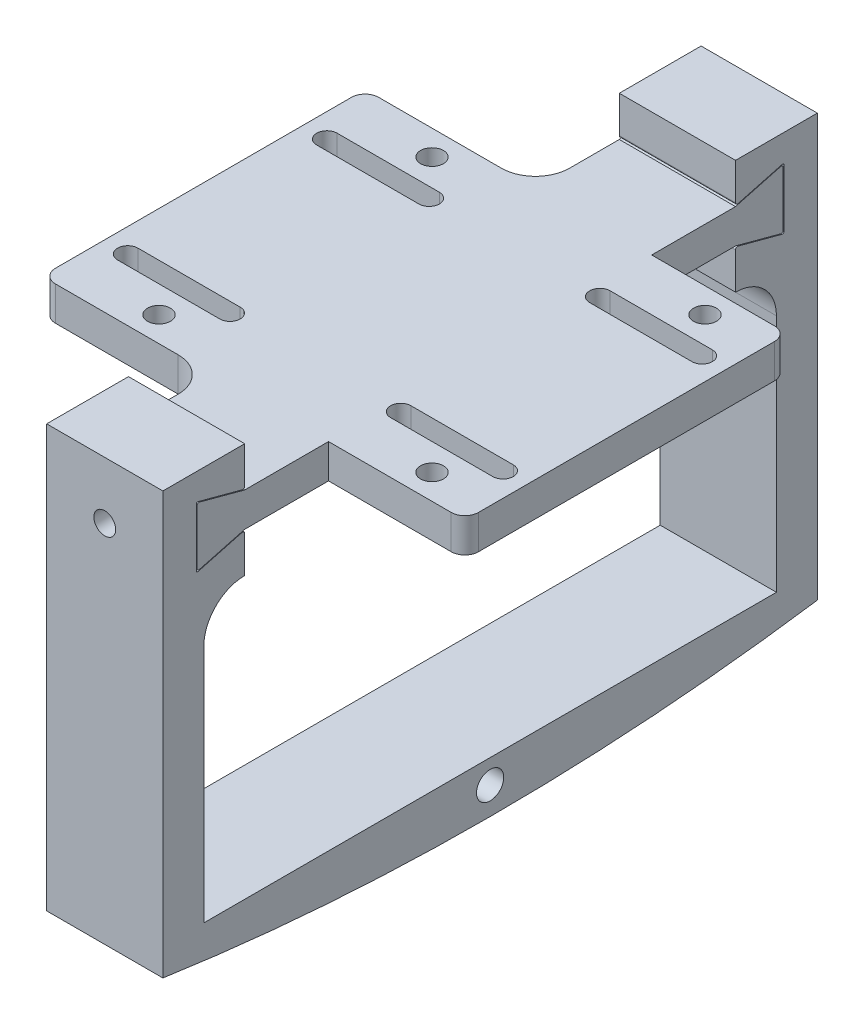
from build123d import *

# Parameters (mm, degrees)
SKETCH1_R                       = 1.6800000000000102
BOSS_EXTRUDE1_DEPTH             = 5
SKETCH3_W                       = 17.05000000000101
SKETCH3_H                       = 19.294999999999526
BOSS_EXTRUDE2_DEPTH             = 5
BOSS_EXTRUDE3_DEPTH             = 17.05
FILLET1_R                       = 5
BOSS_EXTRUDE4_REACH             = 56.956
SKETCH7_R                       = 2.000000000000002
BOSS_EXTRUDE4_DIRECTION_2_REACH = 56.956
CUT_EXTRUDE1_DEPTH              = 88.24936962523023
CUT_EXTRUDE2_DEPTH              = 114.2388449815347
FILLET2_R                       = 0.3
FILLET3_R                       = 0.3
FILLET4_R                       = 0.2
FILLET5_R                       = 6
SKETCH11_R                      = 1.6000000000000003
CUT_EXTRUDE3_DEPTH              = 15


with BuildPart() as part:
    # Sketch1 → Boss-Extrude1 (new body)
    with BuildSketch(Plane(origin=(0, 0, 0), x_dir=(1, 0, 0), z_dir=(0, 1, 0))):
        with BuildLine():
            Line((26.52500000000002, 23.705000000000474), (-31.52499999999999, 23.70499999999999))
            ThreePointArc((-31.52499999999999, 23.70499999999999), (-32.93921356237309, 23.119213562373083), (-33.52499999999999, 21.704999999999988))
            Line((-33.52499999999999, 21.704999999999988), (-33.52499999999999, -21.704999999999988))
            ThreePointArc((-33.52499999999999, -21.704999999999988), (-32.93921356237309, -23.119213562373083), (-31.52499999999999, -23.70499999999999))
            Line((-31.52499999999999, -23.70499999999999), (26.52500000000002, -23.705000000000474))
            ThreePointArc((26.52500000000002, -23.705000000000474), (27.93921356237312, -23.11921356237357), (28.525000000000023, -21.705000000000474))
            Line((28.525000000000023, -21.705000000000474), (28.525000000000023, 21.705000000000474))
            ThreePointArc((28.525000000000023, 21.705000000000474), (27.939213562373116, 23.11921356237357), (26.52500000000002, 23.705000000000474))
        make_face()
        with Locations(Location((-20.025000000000404, 20.025000000000126, 0), (0, 0, 270))):
            Circle(SKETCH1_R, mode=Mode.SUBTRACT)
        with Locations(Location((20.025000000000404, -20.025000000000237, 0), (0, 0, 90))):
            Circle(SKETCH1_R, mode=Mode.SUBTRACT)
        with Locations(Location((20.025000000000183, 20.025000000000347, 0), (0, 0, 270))):
            Circle(SKETCH1_R, mode=Mode.SUBTRACT)
        with Locations(Location((-20.025000000000126, -20.02500000000057, 0), (0, 0, 90))):
            Circle(SKETCH1_R, mode=Mode.SUBTRACT)
        with BuildLine():
            Line((10.025000000000507, 16.10500000000037), (25.025000000000187, 16.10500000000037))
            ThreePointArc((25.025000000000187, 16.10500000000037), (26.525000000000297, 14.605000000000478), (25.025000000000187, 13.105000000000366))
            Line((25.025000000000187, 13.105000000000366), (10.025000000000507, 13.105000000000366))
            ThreePointArc((10.025000000000507, 13.105000000000366), (8.525000000000505, 14.605000000000368), (10.025000000000507, 16.10500000000037))
        make_face(mode=Mode.SUBTRACT)
        with BuildLine():
            Line((-30.025, 16.104999999999997), (-15.024999999999993, 16.104999999999997))
            ThreePointArc((-15.024999999999993, 16.104999999999997), (-13.524999999999993, 14.604999999999993), (-15.025000000000004, 13.104999999999995))
            Line((-15.025000000000004, 13.104999999999995), (-30.024999999999988, 13.104999999999995))
            ThreePointArc((-30.024999999999988, 13.104999999999995), (-31.525, 14.604999999999993), (-30.025, 16.104999999999997))
        make_face(mode=Mode.SUBTRACT)
        with BuildLine():
            Line((-30.024999999999988, -16.105), (-15.024999999999993, -16.104999999999997))
            ThreePointArc((-15.024999999999993, -16.104999999999997), (-13.52499999999999, -14.604999999999999), (-15.024999999999993, -13.104999999999992))
            Line((-15.024999999999993, -13.104999999999992), (-30.024999999999988, -13.104999999999995))
            ThreePointArc((-30.024999999999988, -13.104999999999995), (-31.525, -14.604999999999999), (-30.024999999999988, -16.105))
        make_face(mode=Mode.SUBTRACT)
        with BuildLine():
            Line((10.025000000000507, -16.10500000000037), (25.025000000000187, -16.10500000000037))
            ThreePointArc((25.025000000000187, -16.10500000000037), (26.525000000000077, -14.605000000000256), (25.025000000000187, -13.105000000000366))
            Line((25.025000000000187, -13.105000000000366), (10.025000000000507, -13.105000000000366))
            ThreePointArc((10.025000000000507, -13.105000000000366), (8.525000000000505, -14.605000000000368), (10.025000000000507, -16.10500000000037))
        make_face(mode=Mode.SUBTRACT)
    extrude(amount=-BOSS_EXTRUDE1_DEPTH)

    # Sketch3 → Boss-Extrude2 (add)
    with BuildSketch(Plane(origin=(0, 0, 0), x_dir=(1, 0, 0), z_dir=(0, 1, 0))):
        with Locations((0, 33.352500000000234)):
            Rectangle(SKETCH3_W, SKETCH3_H)
        with Locations((0, -33.352500000000234)):
            Rectangle(SKETCH3_W, SKETCH3_H)
    extrude(amount=-BOSS_EXTRUDE2_DEPTH)

    # Sketch6 → Boss-Extrude3 (add)
    with BuildSketch(Plane(origin=(8.525000000000505, 0, 0), x_dir=(0, 0, -1), z_dir=(1, 0, 0))):
        Polygon((42.99999999999999, 1.8756443470178361), (42.99999999999999, -6.8756443470178334), (36, -4.999999999999998), (36, 0), align=None)
        Polygon((-42.99999999999999, -6.875644347017854), (-36, -4.999999999999998), (-36, -1.821e-14), (-42.99999999999999, 1.8756443470178361), align=None)
    extrude(amount=-BOSS_EXTRUDE3_DEPTH)

    # Fillet1
    fillet1_edges = [part.edges().sort_by_distance(p)[0] for p in [
        (-8.525000000000505, -2.5, -23.705000000000474),
        (-8.525000000000505, -2.5, 23.705000000000474),
    ]]
    fillet(fillet1_edges, radius=FILLET1_R)


with BuildPart() as body_2:

    # Boss-Extrude4: up to this face of the body (flat: up to its plane)
    boss_extrude4_end = Plane(part.part.faces().sort_by_distance((8.525, -2.5, 34.228663099))[0])
    # Sketch7 → Boss-Extrude4 (new, up to the picked face)
    with BuildSketch(Plane(origin=(0, 0, 0), x_dir=(0, 0, -1), z_dir=(1, 0, 0)), mode=Mode.PRIVATE) as boss_extrude4_sk1:
        with BuildLine():
            Line((-47.999999999999986, 5.875644347017835), (-35.99999999999999, 5.875644347017835))
            Line((-35.99999999999999, 5.875644347017835), (-35.99999999999999, -10.875644347017854))
            Line((-35.99999999999999, -10.875644347017854), (-41.999999999999986, -10.875644347017854))
            Line((-41.999999999999986, -10.875644347017854), (-41.99999999999998, -52))
            Line((-41.99999999999998, -52), (41.99999999999998, -52))
            Line((41.99999999999998, -52), (41.999999999999986, -10.875644347017854))
            Line((41.999999999999986, -10.875644347017854), (35.99999999999999, -10.875644347017854))
            Line((35.99999999999999, -10.875644347017854), (35.99999999999999, 5.875644347017835))
            Line((35.99999999999999, 5.875644347017835), (47.999999999999986, 5.875644347017835))
            Line((47.999999999999986, 5.875644347017835), (47.99999999999998, -52))
            Line((47.99999999999998, -52), (47.999999999999986, -55.99999999999999))
            ThreePointArc((47.999999999999986, -55.99999999999999), (2.243e-14, -59.5), (-47.999999999999986, -55.99999999999999))
            Line((-47.999999999999986, -55.99999999999999), (-47.99999999999998, -52))
            Line((-47.99999999999998, -52), (-47.999999999999986, 5.875644347017835))
        make_face()
        with Locations(Location((0, -55.5, 0), (0, 0, 180))):
            Circle(SKETCH7_R, mode=Mode.SUBTRACT)
    boss_extrude4_tool1 = split(extrude(boss_extrude4_sk1.sketch, amount=BOSS_EXTRUDE4_REACH, mode=Mode.PRIVATE), bisect_by=boss_extrude4_end, keep=Keep.BOTH, mode=Mode.PRIVATE)
    add(boss_extrude4_tool1.solids().sort_by(Axis((0, 4.714181, 42), (1, 0, 0)))[0])


    # Boss-Extrude4 direction 2: up to this face of the body (flat: up to its plane)
    boss_extrude4_direction_2_end = Plane(part.part.faces().sort_by_distance((-8.525, -2.5, 36.599595529))[0])
    # Sketch7 → Boss-Extrude4 direction 2 (add, up to the picked face)
    with BuildSketch(Plane(origin=(0, 0, 0), x_dir=(0, 0, -1), z_dir=(1, 0, 0)), mode=Mode.PRIVATE) as boss_extrude4_direction_2_sk1:
        with BuildLine():
            Line((-47.999999999999986, 5.875644347017835), (-35.99999999999999, 5.875644347017835))
            Line((-35.99999999999999, 5.875644347017835), (-35.99999999999999, -10.875644347017854))
            Line((-35.99999999999999, -10.875644347017854), (-41.999999999999986, -10.875644347017854))
            Line((-41.999999999999986, -10.875644347017854), (-41.99999999999998, -52))
            Line((-41.99999999999998, -52), (41.99999999999998, -52))
            Line((41.99999999999998, -52), (41.999999999999986, -10.875644347017854))
            Line((41.999999999999986, -10.875644347017854), (35.99999999999999, -10.875644347017854))
            Line((35.99999999999999, -10.875644347017854), (35.99999999999999, 5.875644347017835))
            Line((35.99999999999999, 5.875644347017835), (47.999999999999986, 5.875644347017835))
            Line((47.999999999999986, 5.875644347017835), (47.99999999999998, -52))
            Line((47.99999999999998, -52), (47.999999999999986, -55.99999999999999))
            ThreePointArc((47.999999999999986, -55.99999999999999), (2.243e-14, -59.5), (-47.999999999999986, -55.99999999999999))
            Line((-47.999999999999986, -55.99999999999999), (-47.99999999999998, -52))
            Line((-47.99999999999998, -52), (-47.999999999999986, 5.875644347017835))
        make_face()
        with Locations(Location((0, -55.5, 0), (0, 0, 180))):
            Circle(SKETCH7_R, mode=Mode.SUBTRACT)
    boss_extrude4_direction_2_tool1 = split(extrude(boss_extrude4_direction_2_sk1.sketch, amount=-BOSS_EXTRUDE4_DIRECTION_2_REACH, mode=Mode.PRIVATE), bisect_by=boss_extrude4_direction_2_end, keep=Keep.BOTH, mode=Mode.PRIVATE)
    add(boss_extrude4_direction_2_tool1.solids().sort_by(Axis((0, 4.714181, 42), (-1, 0, 0)))[0])

    # Sketch6<2> → Cut-Extrude1 (cut, through all)
    with BuildSketch(Plane(origin=(8.525000000000505, 0, 0), x_dir=(0, 0, -1), z_dir=(1, 0, 0))):
        Polygon((42.99999999999999, 1.8756443470178361), (42.99999999999999, -6.8756443470178334), (36, -4.999999999999998), (36, 0), align=None)
        Polygon((-42.99999999999999, -6.875644347017854), (-36, -4.999999999999998), (-36, -1.821e-14), (-42.99999999999999, 1.8756443470178361), align=None)
    extrude(amount=-CUT_EXTRUDE1_DEPTH, mode=Mode.SUBTRACT)

    # 3DSketch1 → Cut-Extrude2 (cut, through all)
    with BuildSketch(Plane(origin=(8.525000000000505, -7.005966884301975, 43.099999999999994), x_dir=(0, 0.10398008692504432, -0.9945793791965829), z_dir=(1, 0, 0))):
        Polygon((0, 0), (7.259329392571174, 1.1538682472292239), (7.800759448642486, 6.332698011373968), (0.9370616566221789, 8.963083492938818), align=None)
        Polygon((79.41047475079642, -1.1538682472292203), (78.8690446947251, -6.332698011373965), (85.73274248674544, -8.963083492938818), (86.66980414336761, 0), align=None)
    extrude(amount=-CUT_EXTRUDE2_DEPTH, mode=Mode.SUBTRACT)

    # Fillet3
    fillet3_edges = [body_2.edges().sort_by_distance(p)[0] for p in [
        (0, -5.103527618041005, -35.99999999999997),
        (0, 0.10352761804098698, -35.999999999999986),
        (0, -5.103527618041004, 35.99999999999999),
        (0, 0.10352761804098787, 35.99999999999999),
    ]]
    fillet(fillet3_edges, radius=FILLET3_R)

    # Fillet4
    fillet4_edges = [body_2.edges().sort_by_distance(p)[0] for p in [
        (0, 2.005966884301957, -43.099999999999994),
        (0, -7.005966884301975, -43.10000000000001),
        (0, -7.005966884301975, 43.099999999999994),
        (0, 2.005966884301955, 43.099999999999994),
    ]]
    fillet(fillet4_edges, radius=FILLET4_R)

    # Fillet5
    fillet5_edges = [body_2.edges().sort_by_distance(p)[0] for p in [
        (0, -10.875644347017854, -41.999999999999986),
        (0, -10.875644347017854, 41.999999999999986),
    ]]
    fillet(fillet5_edges, radius=FILLET5_R - 0.0001)  # a hair under: the kernel refuses the full size


with BuildPart() as part_1:
    add(part.part)

    # Fillet2
    fillet2_edges = [part_1.edges().sort_by_distance(p)[0] for p in [
        (5.0449e-13, 1.8756443470178361, -42.99999999999999),
        (5.0449e-13, -6.8756443470178334, -42.99999999999999),
        (5.0449e-13, 1.8756443470178361, 42.99999999999999),
        (5.0449e-13, -6.875644347017854, 42.99999999999999),
    ]]
    fillet(fillet2_edges, radius=FILLET2_R)


with BuildPart() as cut_extrude3_tool:
    # Sketch11 → Cut-Extrude3 (new body)
    with BuildSketch(Plane(origin=(0, 8.327e-14, -47.99999999999989), x_dir=(-1, 0, 0), z_dir=(0, 1.73e-15, -1))):
        with Locations(Location((0, -2.500000000000044, 0), (0, 0, 90))):
            Circle(SKETCH11_R)
    cut_extrude3 = extrude(amount=-CUT_EXTRUDE3_DEPTH)


with BuildPart() as part_2:
    add(part_1.part)

    # Cut-Extrude3: cut by cut_extrude3_tool
    add(cut_extrude3_tool.part, mode=Mode.SUBTRACT)


with BuildPart() as body_2_1:
    add(body_2.part)

    # Cut-Extrude3: cut by cut_extrude3_tool
    add(cut_extrude3_tool.part, mode=Mode.SUBTRACT)


with BuildPart() as mirror1_tool:
    # Mirror1: Cut-Extrude3 across plane
    add(cut_extrude3.mirror(Plane.XY))


with BuildPart() as part_3:
    add(part_2.part)

    # Mirror1: cut by mirror1_tool
    add(mirror1_tool.part, mode=Mode.SUBTRACT)


with BuildPart() as body_2_2:
    add(body_2_1.part)

    # Mirror1: cut by mirror1_tool
    add(mirror1_tool.part, mode=Mode.SUBTRACT)


solid = Compound([part_3.part, body_2_2.part])
